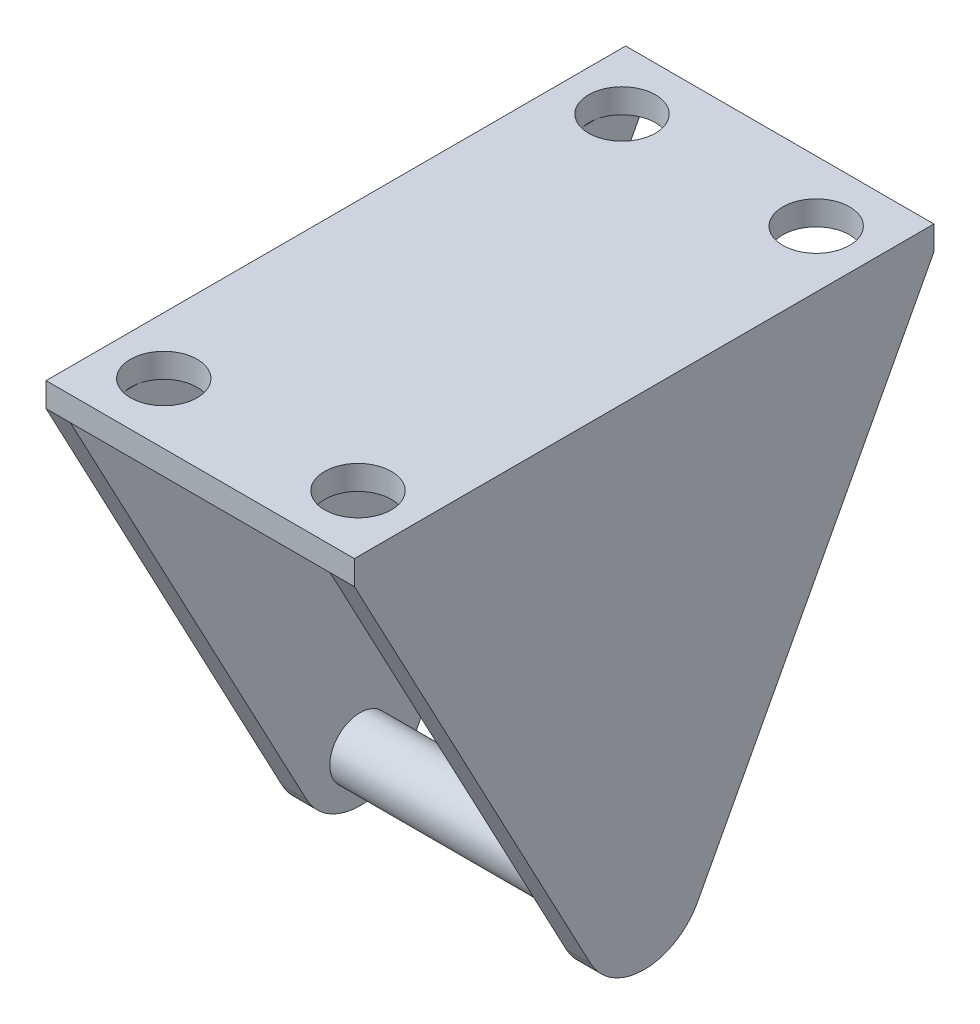
from build123d import *

# Parameters (mm, degrees)
BOSS_EXTRUDE1_DEPTH          = 47.752
CUT_EXTRUDE1_DEPTH           = 47.752
CUT_EXTRUDE1_DEPTH_BACK      = 47.752
BOSS_EXTRUDE6_START          = -10.7
SKETCH3_R                    = 2.5
BOSS_EXTRUDE6_DEPTH          = 10.7
SKETCH3_2_R                  = 2.5
BOSS_EXTRUDE7_DEPTH          = 10.7
M5_START                     = -2
M5_CLEARANCE_HOLE1_OUTLINE_R = 2.75
M5_CLEARANCE_HOLE1_DEPTH     = 2


# Read off the part's stored shape, not the designer's step: M5 Clearance Hole1
with BuildPart() as part:
    # Sketch1 → Boss-Extrude1 (new body)
    with BuildSketch(Plane.XY):
        Polygon((-12.7, -41.275), (-12.7, 0), (12.7, 0), (12.7, -41.275), (10.7, -41.275), (10.7, -2), (-10.7, -2), (-10.7, -41.275), align=None)
    extrude(amount=BOSS_EXTRUDE1_DEPTH)

    # Sketch2 → Cut-Extrude1 (cut, two sides: drawn at the far end of the back side and taken through both)
    with BuildSketch(Plane(origin=(0, 0, 0), x_dir=(0, 0, -1), z_dir=(1, 0, 0)).offset(-CUT_EXTRUDE1_DEPTH_BACK)):
        with BuildLine():
            Line((-23.876, -42.10871549), (-23.876, -41.275))
            ThreePointArc((-23.876, -41.275), (-26.451700932, -40.560529688), (-28.291297125, -38.621305883))
            Line((-28.291297125, -38.621305883), (-47.752, -2))
            Line((-47.752, -2), (-47.752, -42.10871549))
            Line((-47.752, -42.10871549), (-23.876, -42.10871549))
        make_face()
        with BuildLine():
            Line((0, -42.10871549), (0, -2))
            Line((0, -2), (-19.460702875, -38.621305883))
            ThreePointArc((-19.460702875, -38.621305883), (-21.300299068, -40.560529688), (-23.876, -41.275))
            Line((-23.876, -41.275), (-23.876, -42.10871549))
            Line((-23.876, -42.10871549), (0, -42.10871549))
        make_face()
    extrude(amount=CUT_EXTRUDE1_DEPTH + CUT_EXTRUDE1_DEPTH_BACK, mode=Mode.SUBTRACT)

    # Sketch3 → Boss-Extrude6 (add)
    with BuildSketch(Plane(origin=(0, 0, 0), x_dir=(0, 0, -1), z_dir=(1, 0, 0)).offset(BOSS_EXTRUDE6_START)):
        with Locations((-23.876, -37.128004449)):
            Circle(SKETCH3_R)
    extrude(amount=BOSS_EXTRUDE6_DEPTH)

    # Sketch3<2> → Boss-Extrude7 (add)
    with BuildSketch(Plane(origin=(0, 0, 0), x_dir=(0, 0, -1), z_dir=(1, 0, 0))):
        with Locations((-23.876, -37.128004449)):
            Circle(SKETCH3_2_R)
    extrude(amount=BOSS_EXTRUDE7_DEPTH)

    # M5 Clearance Hole1 outline → M5 Clearance Hole1 (cut)
    with BuildSketch(Plane(origin=(0, 0, 0), x_dir=(1, 0, 0), z_dir=(0, 1, 0)).offset(M5_START)):
        with Locations((8, -5)):
            Circle(M5_CLEARANCE_HOLE1_OUTLINE_R)
        with Locations((8, -42.752)):
            Circle(M5_CLEARANCE_HOLE1_OUTLINE_R)
        with Locations((-8, -42.752)):
            Circle(M5_CLEARANCE_HOLE1_OUTLINE_R)
        with Locations((-8, -5)):
            Circle(M5_CLEARANCE_HOLE1_OUTLINE_R)
    extrude(amount=M5_CLEARANCE_HOLE1_DEPTH, mode=Mode.SUBTRACT)


solid = part.part
